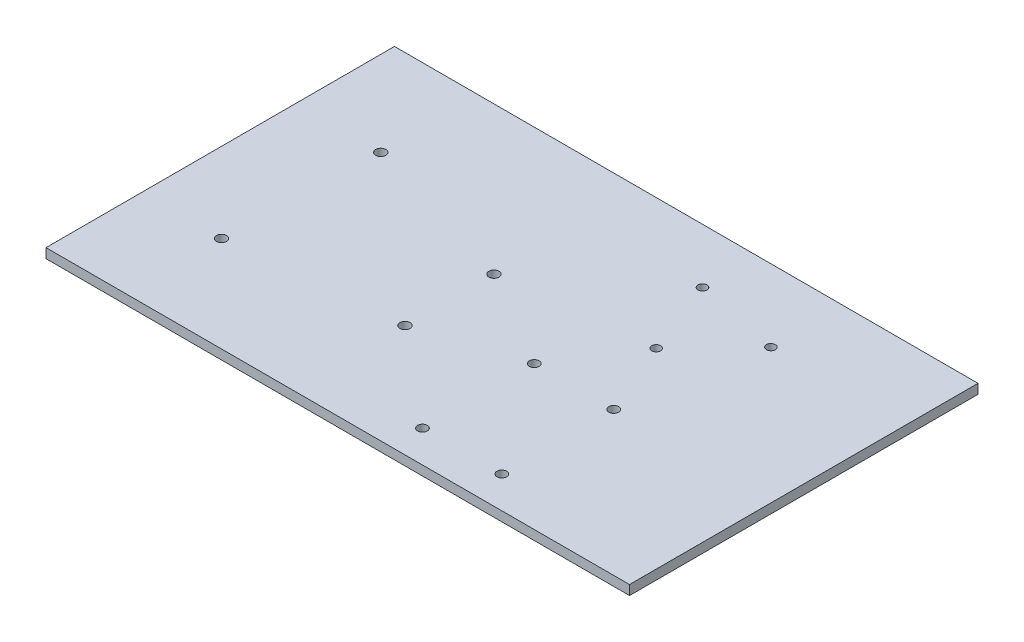
from build123d import *

# Parameters (mm, degrees)
SKETCH1_W           = 182.88
SKETCH1_H           = 109.22
BOSS_EXTRUDE1_DEPTH = 3
SKETCH2_R           = 1.6
CUT_EXTRUDE1_DEPTH  = 10
SKETCH3_R           = 1.3999972
CUT_EXTRUDE2_DEPTH  = 107.548231801
SKETCH4_R           = 1.525
CUT_EXTRUDE3_DEPTH  = 107.548231801


with BuildPart() as part:
    # Sketch1 → Boss-Extrude1 (new body)
    with BuildSketch(Plane(origin=(0, 0, 0), x_dir=(1, 0, 0), z_dir=(0, 1, 0))):
        Rectangle(SKETCH1_W, SKETCH1_H)
    extrude(amount=BOSS_EXTRUDE1_DEPTH)

    # Sketch2 → Cut-Extrude1 (cut)
    with BuildSketch(Plane(origin=(0, 3, 0), x_dir=(1, 0, 0), z_dir=(0, 1, 0))):
        with Locations((-66.44, -24.61)):
            Circle(SKETCH2_R)
        with Locations((-64.84, 23.69)):
            Circle(SKETCH2_R)
        with Locations((-14.04, 8.39)):
            Circle(SKETCH2_R)
        with Locations((-14.04, -19.51)):
            Circle(SKETCH2_R)
    extrude(amount=-CUT_EXTRUDE1_DEPTH, mode=Mode.SUBTRACT)

    # Sketch3 → Cut-Extrude2 (cut, through all)
    with BuildSketch(Plane(origin=(0, 3, 0), x_dir=(1, 0, 0), z_dir=(0, 1, 0))):
        with Locations((31.492075961, 13.689455095)):
            Circle(SKETCH3_R)
        with Locations((22.230331918, 37.469499192)):
            Circle(SKETCH3_R)
        with Locations((49.176341857, 31.977455095)):
            Circle(SKETCH3_R)
    extrude(amount=-CUT_EXTRUDE2_DEPTH, mode=Mode.SUBTRACT)

    # Sketch4 → Cut-Extrude3 (cut, through all)
    with BuildSketch(Plane(origin=(0, 3, 0), x_dir=(1, 0, 0), z_dir=(0, 1, 0))):
        with Locations((16.55, -44.61)):
            Circle(SKETCH4_R)
        with Locations((41.44, -9.56)):
            Circle(SKETCH4_R)
        with Locations((16.55, -9.56)):
            Circle(SKETCH4_R)
        with Locations((41.44, -44.61)):
            Circle(SKETCH4_R)
    extrude(amount=-CUT_EXTRUDE3_DEPTH, mode=Mode.SUBTRACT)


solid = part.part
